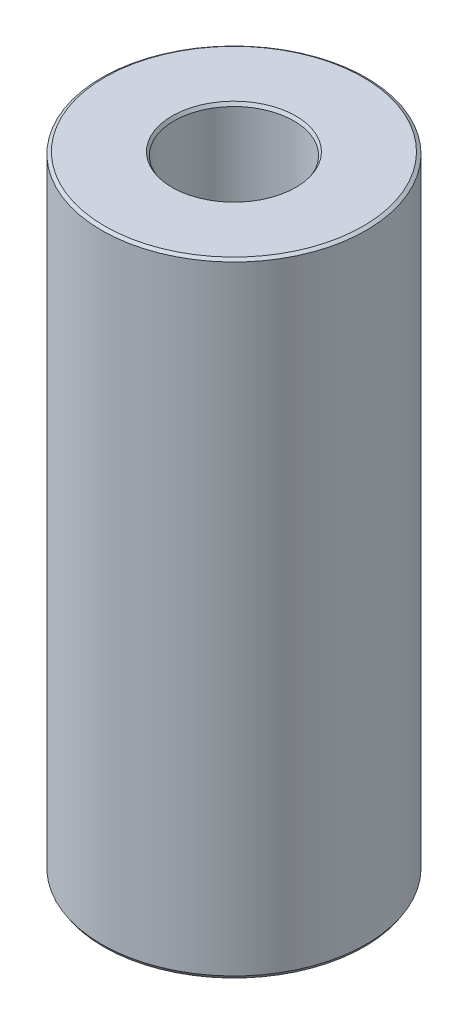
from build123d import *
from OCP.BRepFilletAPI import BRepFilletAPI_MakeChamfer

# Parameters (mm, degrees)
SKETCH1_R           = 60
BOSS_EXTRUDE1_DEPTH = 282.779953126
SKETCH2_R           = 27.155928805
CUT_EXTRUDE1_DEPTH  = 296.236349202
CHAMFER1_SIZE       = 0.91515436
CHAMFER1_SIZE2      = 1.454045827


with BuildPart() as part:
    # Sketch1 → Boss-Extrude1 (new body)
    with BuildSketch(Plane(origin=(0, 0, 0), x_dir=(1, 0, 0), z_dir=(0, 1, 0))):
        Circle(SKETCH1_R)
    extrude(amount=BOSS_EXTRUDE1_DEPTH)

    # Sketch2 → Cut-Extrude1 (cut, through all)
    with BuildSketch(Plane(origin=(0, 0, 0), x_dir=(1, 0, 0), z_dir=(0, 1, 0))):
        Circle(SKETCH2_R)
    extrude(amount=CUT_EXTRUDE1_DEPTH, mode=Mode.SUBTRACT)

    # Chamfer1: one chamfer whose edges measure the first distance from different faces: ONE call of the kernel's chamfer builder (chamfer() names one face for all edges)
    chamfer1_edges_1 = [part.edges().sort_by_distance(p)[0] for p in [
        (-27.155928805, 282.779953126, 0),
    ]]
    chamfer1_side_1 = [part.faces().sort_by_distance(p)[0] for p in [
        (-58.302943725, 282.779953126, 0),
    ]]
    chamfer1_edges_2 = [part.edges().sort_by_distance(p)[0] for p in [
        (-27.155928805, 0, 0),
    ]]
    chamfer1_side_2 = [part.faces().sort_by_distance(p)[0] for p in [
        (-27.155928805, 141.389976563, 0),
    ]]
    chamfer1_edges_3 = [part.edges().sort_by_distance(p)[0] for p in [
        (-60, 0, 0),
    ]]
    chamfer1_side_3 = [part.faces().sort_by_distance(p)[0] for p in [
        (-58.302943725, 0, 0),
    ]]
    chamfer1_edges_4 = [part.edges().sort_by_distance(p)[0] for p in [
        (-60, 282.779953126, 0),
    ]]
    chamfer1_side_4 = [part.faces().sort_by_distance(p)[0] for p in [
        (-60, 141.389976563, 0),
    ]]
    chamfer1 = BRepFilletAPI_MakeChamfer(part.part.solid().wrapped)
    for e in chamfer1_edges_1:
        chamfer1.Add(CHAMFER1_SIZE, CHAMFER1_SIZE2, e.wrapped, chamfer1_side_1[0].wrapped)  # the first distance lies on this face
    for e in chamfer1_edges_2:
        chamfer1.Add(CHAMFER1_SIZE, CHAMFER1_SIZE2, e.wrapped, chamfer1_side_2[0].wrapped)  # the first distance lies on this face
    for e in chamfer1_edges_3:
        chamfer1.Add(CHAMFER1_SIZE, CHAMFER1_SIZE2, e.wrapped, chamfer1_side_3[0].wrapped)  # the first distance lies on this face
    for e in chamfer1_edges_4:
        chamfer1.Add(CHAMFER1_SIZE, CHAMFER1_SIZE2, e.wrapped, chamfer1_side_4[0].wrapped)  # the first distance lies on this face
    add(Compound.cast(chamfer1.Shape()), mode=Mode.REPLACE)


solid = part.part
